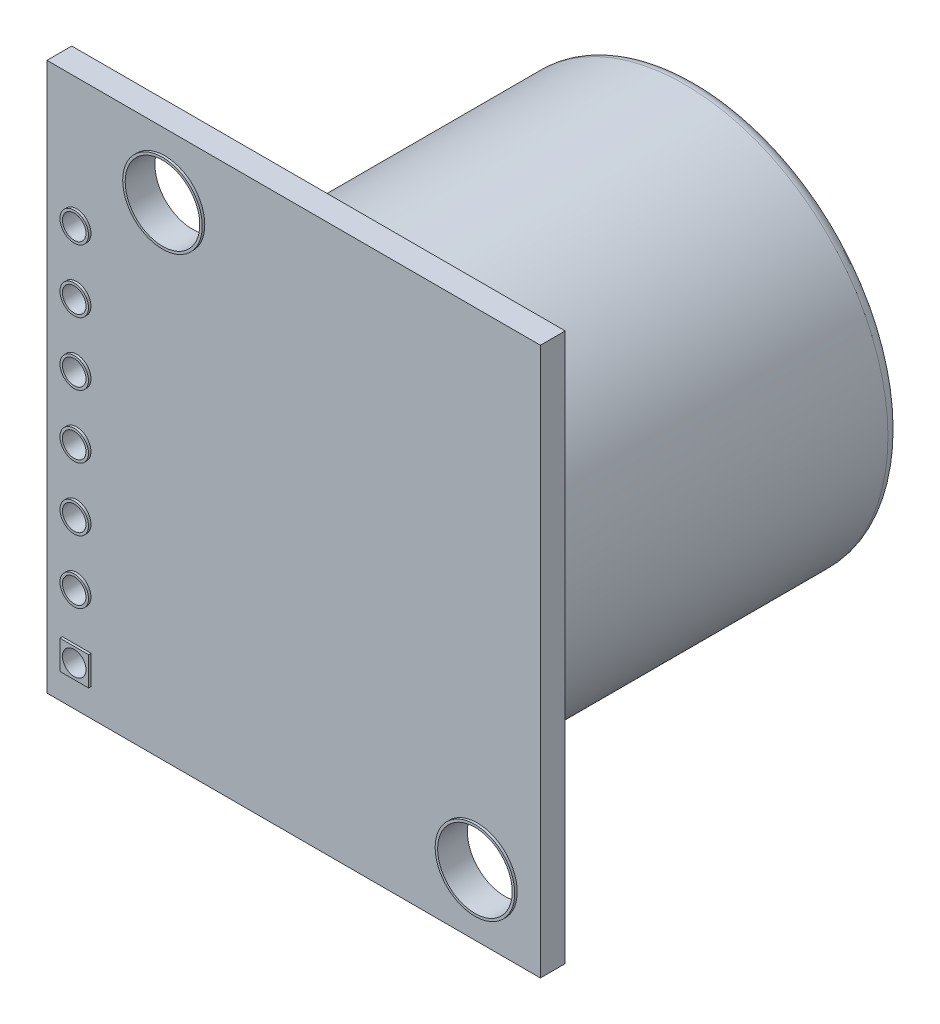
from build123d import *

# Parameters (mm, degrees)
SKETCH1_W                = 19.9
SKETCH1_H                = 22.1
SKETCH1_R                = 1.55
SKETCH1_R_2              = 0.5
BOSS_EXTRUDE1_DEPTH      = 1
SKETCH2_R                = 8.2
BOSS_EXTRUDE2_DEPTH      = 14.4
FILLET1_R                = 0.5
BOSS_EXTRUDE3_DEPTH      = 0.1
BOSS_EXTRUDE3_DEPTH_BACK = 1.1
SKETCH3_R                = 1.605
SKETCH3_R_2              = 1.505
SKETCH3_R_3              = 0.575
SKETCH3_R_4              = 0.475
SKETCH3_W                = 1.162115218
SKETCH3_H                = 1.162115218
SKETCH4_R                = 6.422617975
BOSS_EXTRUDE4_DEPTH      = 8
SKETCH5_R                = 4.769307598
CUT_EXTRUDE1_DEPTH       = 1
SKETCH6_R                = 4.669307598
BOSS_EXTRUDE5_DEPTH      = 3
FILLET2_R                = 0.5
SKETCH7_R                = 7.7
SKETCH7_R_2              = 1
BOSS_EXTRUDE6_DEPTH      = 0.1


# Read off the part's stored shape, not the designer's step: Shell1
with BuildPart() as part:
    # Sketch1 → Boss-Extrude1 (new body)
    with BuildSketch(Plane.XY):
        Rectangle(SKETCH1_W, SKETCH1_H)
        with Locations((-5.19, 8.49)):
            Circle(SKETCH1_R, mode=Mode.SUBTRACT)
        with Locations((7.41, -8.51)):
            Circle(SKETCH1_R, mode=Mode.SUBTRACT)
        with Locations((-8.75, -9.35)):
            Circle(SKETCH1_R_2, mode=Mode.SUBTRACT)
        with Locations((-8.75, -6.81)):
            Circle(SKETCH1_R_2, mode=Mode.SUBTRACT)
        with Locations((-8.75, -4.27)):
            Circle(SKETCH1_R_2, mode=Mode.SUBTRACT)
        with Locations((-8.75, -1.73)):
            Circle(SKETCH1_R_2, mode=Mode.SUBTRACT)
        with Locations((-8.75, 0.81)):
            Circle(SKETCH1_R_2, mode=Mode.SUBTRACT)
        with Locations((-8.75, 3.35)):
            Circle(SKETCH1_R_2, mode=Mode.SUBTRACT)
        with Locations((-8.75, 5.89)):
            Circle(SKETCH1_R_2, mode=Mode.SUBTRACT)
    extrude(amount=BOSS_EXTRUDE1_DEPTH)

    # Sketch3 → Boss-Extrude3 (add, two sides: drawn at the far end of the back side and taken through both)
    # profile 1 of 9: a face of its own
    with BuildSketch(Plane(origin=(0, 0, 0), x_dir=(-1, 0, 0), z_dir=(0, 0, -1)).offset(-BOSS_EXTRUDE3_DEPTH_BACK)):
        with Locations((-7.41, -8.51)):
            Circle(SKETCH3_R)
        with Locations((-7.41, -8.51)):
            Circle(SKETCH3_R_2, mode=Mode.SUBTRACT)
    # profile 2 of 9: a face of its own
    with BuildSketch(Plane(origin=(0, 0, 0), x_dir=(-1, 0, 0), z_dir=(0, 0, -1)).offset(-BOSS_EXTRUDE3_DEPTH_BACK)):
        with Locations((5.19, 8.49)):
            Circle(SKETCH3_R)
        with Locations((5.19, 8.49)):
            Circle(SKETCH3_R_2, mode=Mode.SUBTRACT)
    # profile 3 of 9: a face of its own
    with BuildSketch(Plane(origin=(0, 0, 0), x_dir=(-1, 0, 0), z_dir=(0, 0, -1)).offset(-BOSS_EXTRUDE3_DEPTH_BACK)):
        with Locations((8.75, 5.89)):
            Circle(SKETCH3_R_3)
        with Locations((8.75, 5.89)):
            Circle(SKETCH3_R_4, mode=Mode.SUBTRACT)
    # profile 4 of 9: a face of its own
    with BuildSketch(Plane(origin=(0, 0, 0), x_dir=(-1, 0, 0), z_dir=(0, 0, -1)).offset(-BOSS_EXTRUDE3_DEPTH_BACK)):
        with Locations((8.75, 3.35)):
            Circle(SKETCH3_R_3)
        with Locations((8.75, 3.35)):
            Circle(SKETCH3_R_4, mode=Mode.SUBTRACT)
    # profile 5 of 9: a face of its own
    with BuildSketch(Plane(origin=(0, 0, 0), x_dir=(-1, 0, 0), z_dir=(0, 0, -1)).offset(-BOSS_EXTRUDE3_DEPTH_BACK)):
        with Locations((8.75, 0.81)):
            Circle(SKETCH3_R_3)
        with Locations((8.75, 0.81)):
            Circle(SKETCH3_R_4, mode=Mode.SUBTRACT)
    # profile 6 of 9: a face of its own
    with BuildSketch(Plane(origin=(0, 0, 0), x_dir=(-1, 0, 0), z_dir=(0, 0, -1)).offset(-BOSS_EXTRUDE3_DEPTH_BACK)):
        with Locations((8.75, -1.73)):
            Circle(SKETCH3_R_3)
        with Locations((8.75, -1.73)):
            Circle(SKETCH3_R_4, mode=Mode.SUBTRACT)
    # profile 7 of 9: a face of its own
    with BuildSketch(Plane(origin=(0, 0, 0), x_dir=(-1, 0, 0), z_dir=(0, 0, -1)).offset(-BOSS_EXTRUDE3_DEPTH_BACK)):
        with Locations((8.75, -4.27)):
            Circle(SKETCH3_R_3)
        with Locations((8.75, -4.27)):
            Circle(SKETCH3_R_4, mode=Mode.SUBTRACT)
    # profile 8 of 9: a face of its own
    with BuildSketch(Plane(origin=(0, 0, 0), x_dir=(-1, 0, 0), z_dir=(0, 0, -1)).offset(-BOSS_EXTRUDE3_DEPTH_BACK)):
        with Locations((8.75, -6.81)):
            Circle(SKETCH3_R_3)
        with Locations((8.75, -6.81)):
            Circle(SKETCH3_R_4, mode=Mode.SUBTRACT)
    # profile 9 of 9: a face of its own
    with BuildSketch(Plane(origin=(0, 0, 0), x_dir=(-1, 0, 0), z_dir=(0, 0, -1)).offset(-BOSS_EXTRUDE3_DEPTH_BACK)):
        with Locations((8.75, -9.35)):
            Rectangle(SKETCH3_W, SKETCH3_H)
        with Locations((8.75, -9.35)):
            Circle(SKETCH3_R_4, mode=Mode.SUBTRACT)
    extrude(amount=BOSS_EXTRUDE3_DEPTH + BOSS_EXTRUDE3_DEPTH_BACK)


with BuildPart() as body_2:
    # Sketch2 → Boss-Extrude2 (new body)
    with BuildSketch(Plane(origin=(0, 0, -0.3), x_dir=(-1, 0, 0), z_dir=(0, 0, -1))):
        with Locations((-0.56587125, -0.326464182)):
            Circle(SKETCH2_R)
    extrude(amount=BOSS_EXTRUDE2_DEPTH)

    # Fillet1
    fillet1_edges = [body_2.edges().sort_by_distance(p)[0] for p in [
        (8.76587125, -0.326464182, -14.7),
    ]]
    fillet(fillet1_edges, radius=FILLET1_R)

    # Shell1 outline → Shell1 (revolve, cut)
    with BuildSketch(Plane(origin=(0.56587125, -0.326464182, 0), x_dir=(1, 0, 0), z_dir=(0, -1, 0))):
        with BuildLine():
            Line((8.1, -0.3), (0, -0.3))
            Line((0, -0.3), (0, -14.7))
            Line((0, -14.7), (7.7, -14.7))
            Line((7.7, -14.7), (7.7, -14.6))
            ThreePointArc((7.7, -14.6), (7.982842712, -14.482842712), (8.1, -14.2))
            Line((8.1, -14.2), (8.1, -0.3))
        make_face()
    revolve(axis=Axis((0.56587125, -0.326464182, 0), (0, 0, 1)), mode=Mode.SUBTRACT)

    # Sketch7 → Boss-Extrude6 (add)
    with BuildSketch(Plane(origin=(0, 0, -14.7), x_dir=(-1, 0, 0), z_dir=(0, 0, -1))):
        with Locations((-0.56587125, -0.326464182)):
            Circle(SKETCH7_R)
        with Locations((-0.56587125, -0.326464182)):
            Circle(SKETCH7_R_2, mode=Mode.SUBTRACT)
        with BuildLine():
            Line((-6.66067126, -2.426720611), (-6.75470414, -2.460945781))
            ThreePointArc((-6.75470414, -2.460945781), (-6.954851632, -2.647735871), (-6.959301524, -2.92146887))
            ThreePointArc((-6.959301524, -2.92146887), (-5.44490804, -5.205500973), (-3.160875938, -6.719894457))
            ThreePointArc((-3.160875938, -6.719894457), (-2.887142938, -6.715444565), (-2.700352848, -6.515297072))
            Line((-2.700352848, -6.515297072), (-2.666127678, -6.421264193))
            ThreePointArc((-2.666127678, -6.421264193), (-2.675125335, -6.159545375), (-2.863205817, -5.977327292))
            ThreePointArc((-2.863205817, -5.977327292), (-4.879222615, -4.639815548), (-6.216734359, -2.62379875))
            ThreePointArc((-6.216734359, -2.62379875), (-6.398952442, -2.435718268), (-6.66067126, -2.426720611))
        make_face(mode=Mode.SUBTRACT)
        with BuildLine():
            Line((1.534385179, -6.421264193), (1.568610349, -6.515297072))
            ThreePointArc((1.568610349, -6.515297072), (1.755400439, -6.715444565), (2.029133438, -6.719894457))
            ThreePointArc((2.029133438, -6.719894457), (4.313165541, -5.205500973), (5.827559025, -2.92146887))
            ThreePointArc((5.827559025, -2.92146887), (5.823109133, -2.647735871), (5.62296164, -2.460945781))
            Line((5.62296164, -2.460945781), (5.528928761, -2.426720611))
            ThreePointArc((5.528928761, -2.426720611), (5.267209943, -2.435718268), (5.08499186, -2.62379875))
            ThreePointArc((5.08499186, -2.62379875), (3.747480116, -4.639815548), (1.731463318, -5.977327292))
            ThreePointArc((1.731463318, -5.977327292), (1.543382836, -6.159545375), (1.534385179, -6.421264193))
        make_face(mode=Mode.SUBTRACT)
        with BuildLine():
            Line((5.528928761, 1.773792246), (5.62296164, 1.808017416))
            ThreePointArc((5.62296164, 1.808017416), (5.823109133, 1.994807506), (5.827559025, 2.268540506))
            ThreePointArc((5.827559025, 2.268540506), (4.313165541, 4.552572608), (2.029133438, 6.066966092))
            ThreePointArc((2.029133438, 6.066966092), (1.755400439, 6.0625162), (1.568610349, 5.862368708))
            Line((1.568610349, 5.862368708), (1.534385179, 5.768335828))
            ThreePointArc((1.534385179, 5.768335828), (1.543382836, 5.50661701), (1.731463318, 5.324398927))
            ThreePointArc((1.731463318, 5.324398927), (3.747480116, 3.986887183), (5.08499186, 1.970870385))
            ThreePointArc((5.08499186, 1.970870385), (5.267209943, 1.782789903), (5.528928761, 1.773792246))
        make_face(mode=Mode.SUBTRACT)
        with BuildLine():
            Line((-2.666127678, 5.768335828), (-2.700352848, 5.862368708))
            ThreePointArc((-2.700352848, 5.862368708), (-2.887142938, 6.0625162), (-3.160875938, 6.066966092))
            ThreePointArc((-3.160875938, 6.066966092), (-5.44490804, 4.552572608), (-6.959301524, 2.268540506))
            ThreePointArc((-6.959301524, 2.268540506), (-6.954851632, 1.994807506), (-6.75470414, 1.808017416))
            Line((-6.75470414, 1.808017416), (-6.66067126, 1.773792246))
            ThreePointArc((-6.66067126, 1.773792246), (-6.398952442, 1.782789903), (-6.216734359, 1.970870385))
            ThreePointArc((-6.216734359, 1.970870385), (-4.879222615, 3.986887183), (-2.863205817, 5.324398927))
            ThreePointArc((-2.863205817, 5.324398927), (-2.675125335, 5.50661701), (-2.666127678, 5.768335828))
        make_face(mode=Mode.SUBTRACT)
        with BuildLine():
            Line((-2.993424849, -4.277031676), (-3.045924604, -4.362469059))
            ThreePointArc((-3.045924604, -4.362469059), (-3.084924804, -4.63949344), (-2.908492258, -4.85659959))
            ThreePointArc((-2.908492258, -4.85659959), (-0.564693275, -5.426464046), (1.778842209, -4.855516931))
            ThreePointArc((1.778842209, -4.855516931), (1.953837337, -4.643018442), (1.921039393, -4.369699585))
            Line((1.921039393, -4.369699585), (1.87098557, -4.28300382))
            ThreePointArc((1.87098557, -4.28300382), (1.666361385, -4.122145573), (1.407271995, -4.147027719))
            ThreePointArc((1.407271995, -4.147027719), (-0.563584889, -4.626463575), (-2.534950502, -4.149123845))
            ThreePointArc((-2.534950502, -4.149123845), (-2.78927777, -4.123144528), (-2.993424849, -4.277031676))
        make_face(mode=Mode.SUBTRACT)
        with BuildLine():
            Line((3.384696244, -2.754017782), (3.470133627, -2.806517537))
            ThreePointArc((3.470133627, -2.806517537), (3.747158008, -2.845517736), (3.964264158, -2.669085191))
            ThreePointArc((3.964264158, -2.669085191), (4.534128614, -0.325286208), (3.963181499, 2.018249276))
            ThreePointArc((3.963181499, 2.018249276), (3.75068301, 2.193244404), (3.477364153, 2.16044646))
            Line((3.477364153, 2.16044646), (3.390668388, 2.110392637))
            ThreePointArc((3.390668388, 2.110392637), (3.229810141, 1.905768452), (3.254692287, 1.646679063))
            ThreePointArc((3.254692287, 1.646679063), (3.734128143, -0.324177822), (3.256788413, -2.295543435))
            ThreePointArc((3.256788413, -2.295543435), (3.230809096, -2.549870703), (3.384696244, -2.754017782))
        make_face(mode=Mode.SUBTRACT)
        with BuildLine():
            Line((-4.516438743, 2.101089417), (-4.601876126, 2.153589172))
            ThreePointArc((-4.601876126, 2.153589172), (-4.878900507, 2.192589372), (-5.096006657, 2.016156826))
            ThreePointArc((-5.096006657, 2.016156826), (-5.665871114, -0.327642157), (-5.094923998, -2.671177641))
            ThreePointArc((-5.094923998, -2.671177641), (-4.882425509, -2.846172769), (-4.609106652, -2.813374825))
            Line((-4.609106652, -2.813374825), (-4.522410888, -2.763321002))
            ThreePointArc((-4.522410888, -2.763321002), (-4.36155264, -2.558696817), (-4.386434786, -2.299607427))
            ThreePointArc((-4.386434786, -2.299607427), (-4.865870642, -0.328750543), (-4.388530912, 1.64261507))
            ThreePointArc((-4.388530912, 1.64261507), (-4.362551595, 1.896942338), (-4.516438743, 2.101089417))
        make_face(mode=Mode.SUBTRACT)
        with BuildLine():
            Line((1.86168235, 3.624103311), (1.914182105, 3.709540694))
            ThreePointArc((1.914182105, 3.709540694), (1.953182304, 3.986565075), (1.776749759, 4.203671225))
            ThreePointArc((1.776749759, 4.203671225), (-0.567049224, 4.773535682), (-2.910584708, 4.202588566))
            ThreePointArc((-2.910584708, 4.202588566), (-3.085579836, 3.990090077), (-3.052781892, 3.71677122))
            Line((-3.052781892, 3.71677122), (-3.002728069, 3.630075456))
            ThreePointArc((-3.002728069, 3.630075456), (-2.798103884, 3.469217208), (-2.539014495, 3.494099354))
            ThreePointArc((-2.539014495, 3.494099354), (-0.56815761, 3.97353521), (1.403208003, 3.49619548))
            ThreePointArc((1.403208003, 3.49619548), (1.657535271, 3.470216163), (1.86168235, 3.624103311))
        make_face(mode=Mode.SUBTRACT)
        with BuildLine():
            Line((-1.488067091, -3.000329331), (-1.520911796, -3.095561067))
            ThreePointArc((-1.520911796, -3.095561067), (-1.717484588, -3.304652833), (-2.004351851, -3.296442896))
            ThreePointArc((-2.004351851, -3.296442896), (-2.899630542, -2.659609605), (-3.536228286, -1.764163412))
            ThreePointArc((-3.536228286, -1.764163412), (-3.544362756, -1.477293999), (-3.335219284, -1.280776219))
            Line((-3.335219284, -1.280776219), (-3.23997891, -1.247956569))
            ThreePointArc((-3.23997891, -1.247956569), (-2.992241811, -1.2554071), (-2.811554404, -1.425057452))
            ThreePointArc((-2.811554404, -1.425057452), (-2.333870714, -2.093998594), (-1.665055261, -2.571858248))
            ThreePointArc((-1.665055261, -2.571858248), (-1.495452449, -2.752590279), (-1.488067091, -3.000329331))
        make_face(mode=Mode.SUBTRACT)
        with BuildLine():
            Line((2.108236411, -1.247956569), (2.203476785, -1.280776219))
            ThreePointArc((2.203476785, -1.280776219), (2.412620257, -1.477293999), (2.404485787, -1.764163412))
            ThreePointArc((2.404485787, -1.764163412), (1.767888043, -2.659609605), (0.872609352, -3.296442896))
            ThreePointArc((0.872609352, -3.296442896), (0.585742089, -3.304652833), (0.389169297, -3.095561067))
            Line((0.389169297, -3.095561067), (0.356324592, -3.000329331))
            ThreePointArc((0.356324592, -3.000329331), (0.36370995, -2.752590279), (0.533312761, -2.571858248))
            ThreePointArc((0.533312761, -2.571858248), (1.202128214, -2.093998594), (1.679811905, -1.425057452))
            ThreePointArc((1.679811905, -1.425057452), (1.860499312, -1.2554071), (2.108236411, -1.247956569))
        make_face(mode=Mode.SUBTRACT)
        with BuildLine():
            Line((-3.23997891, 0.595028204), (-3.335219284, 0.627847855))
            ThreePointArc((-3.335219284, 0.627847855), (-3.544362756, 0.824365634), (-3.536228286, 1.111235047))
            ThreePointArc((-3.536228286, 1.111235047), (-2.899630542, 2.006681241), (-2.004351851, 2.643514531))
            ThreePointArc((-2.004351851, 2.643514531), (-1.717484588, 2.651724468), (-1.520911796, 2.442632702))
            Line((-1.520911796, 2.442632702), (-1.488067091, 2.347400966))
            ThreePointArc((-1.488067091, 2.347400966), (-1.495452449, 2.099661915), (-1.665055261, 1.918929883))
            ThreePointArc((-1.665055261, 1.918929883), (-2.333870714, 1.441070229), (-2.811554404, 0.772129087))
            ThreePointArc((-2.811554404, 0.772129087), (-2.992241811, 0.602478735), (-3.23997891, 0.595028204))
        make_face(mode=Mode.SUBTRACT)
        with BuildLine():
            Line((0.356324592, 2.347400966), (0.389169297, 2.442632702))
            ThreePointArc((0.389169297, 2.442632702), (0.585742089, 2.651724468), (0.872609352, 2.643514531))
            ThreePointArc((0.872609352, 2.643514531), (1.767888043, 2.006681241), (2.404485787, 1.111235047))
            ThreePointArc((2.404485787, 1.111235047), (2.412620257, 0.824365634), (2.203476785, 0.627847855))
            Line((2.203476785, 0.627847855), (2.108236411, 0.595028204))
            ThreePointArc((2.108236411, 0.595028204), (1.860499312, 0.602478735), (1.679811905, 0.772129087))
            ThreePointArc((1.679811905, 0.772129087), (1.202128214, 1.441070229), (0.533312761, 1.918929883))
            ThreePointArc((0.533312761, 1.918929883), (0.36370995, 2.099661915), (0.356324592, 2.347400966))
        make_face(mode=Mode.SUBTRACT)
    extrude(amount=-BOSS_EXTRUDE6_DEPTH)


with BuildPart() as body_3:
    # Sketch4 → Boss-Extrude4 (new body)
    with BuildSketch(Plane(origin=(0, 0, 0), x_dir=(-1, 0, 0), z_dir=(0, 0, -1))):
        with Locations((-0.56587125, -0.326464182)):
            Circle(SKETCH4_R)
    extrude(amount=BOSS_EXTRUDE4_DEPTH)

    # Sketch5 → Cut-Extrude1 (cut)
    with BuildSketch(Plane(origin=(0, 0, -8), x_dir=(-1, 0, 0), z_dir=(0, 0, -1))):
        with Locations((-0.56587125, -0.326464182)):
            Circle(SKETCH5_R)
    extrude(amount=-CUT_EXTRUDE1_DEPTH, mode=Mode.SUBTRACT)

    # Sketch6 → Boss-Extrude5 (add)
    with BuildSketch(Plane(origin=(0, 0, -7), x_dir=(-1, 0, 0), z_dir=(0, 0, -1))):
        with Locations((-0.56587125, -0.326464182)):
            Circle(SKETCH6_R)
    extrude(amount=BOSS_EXTRUDE5_DEPTH)

    # Fillet2
    fillet2_edges = [body_3.edges().sort_by_distance(p)[0] for p in [
        (5.235178848, -0.326464182, -10),
    ]]
    fillet(fillet2_edges, radius=FILLET2_R)


solid = Compound([part.part, body_2.part, body_3.part])
